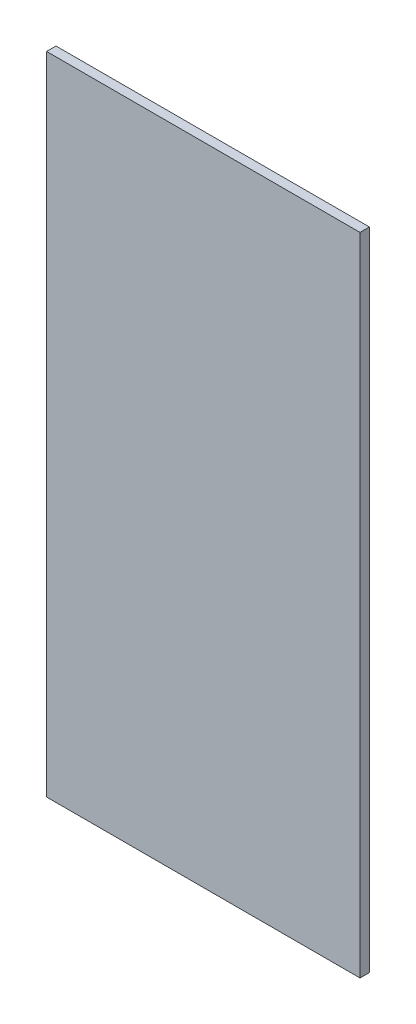
from build123d import *

# Parameters (mm, degrees)
SKETCH1_W           = 200
SKETCH1_H           = 412
BOSS_EXTRUDE1_DEPTH = 6


with BuildPart() as part:
    # Sketch1 → Boss-Extrude1 (new body)
    with BuildSketch(Plane.XY):
        with Locations((71.428571429, 183.104761905)):
            Rectangle(SKETCH1_W, SKETCH1_H)
    extrude(amount=BOSS_EXTRUDE1_DEPTH)


solid = part.part
